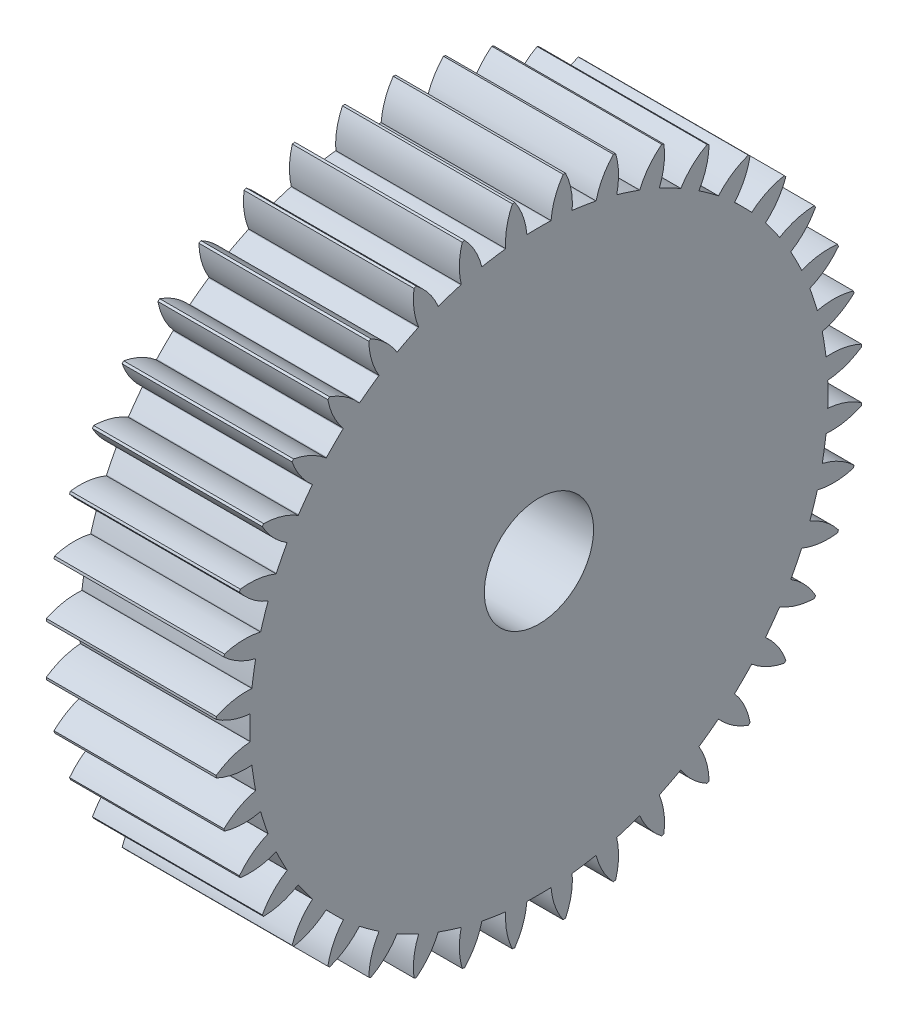
from build123d import *

# Parameters (mm, degrees)
SKETCH1_R                = 133.35
BOSS_EXTRUDE1_DEPTH      = 35
SKETCH6_R                = 22.5
CUT_EXTRUDE4_DEPTH       = 202.157761471
CUT_EXTRUDE5_DEPTH       = 202.157761471
FILLET2_R                = 170
CIRPATTERN2_COUNT        = 40
FILLET2_OF_CIRPATTERN2_R = 170


with BuildPart() as part:
    # Sketch1 → Boss-Extrude1 (new, symmetric)
    with BuildSketch(Plane(origin=(0, 0, 0), x_dir=(0, 0, -1), z_dir=(1, 0, 0))):
        Circle(SKETCH1_R)
    extrude(amount=BOSS_EXTRUDE1_DEPTH, both=True)

    # Sketch6 → Cut-Extrude4 (cut, through all)
    with BuildSketch(Plane(origin=(35, 0, 0), x_dir=(0, 0, -1), z_dir=(1, 0, 0))):
        Circle(SKETCH6_R)
    extrude(amount=-CUT_EXTRUDE4_DEPTH, mode=Mode.SUBTRACT)

    # Sketch7 → Cut-Extrude5 (cut, through all)
    with BuildSketch(Plane(origin=(35, 0, 0), x_dir=(0, 0, -1), z_dir=(1, 0, 0))):
        with BuildLine():
            Line((0, 119.099984062), (-4.985, 118.960598519))
            ThreePointArc((-4.985, 118.960598519), (-6.564205973, 126.294544475), (-9.975, 132.976395932))
            Line((-9.975, 132.976395932), (0, 140.975848521))
            Line((0, 140.975848521), (9.975, 132.976395932))
            ThreePointArc((9.975, 132.976395932), (6.564205973, 126.294544475), (4.985, 118.960598519))
            Line((4.985, 118.960598519), (0, 119.099984062))
        make_face()
    cut_extrude5 = extrude(amount=-CUT_EXTRUDE5_DEPTH, mode=Mode.SUBTRACT)

    # Fillet2
    # the kernel refuses this fillet: 170 mm, written as the material it takes off along each edge
    with BuildSketch(Plane(origin=(46.883421439, 119.099984062, 0), x_dir=(0, -0.027950067836470454, -0.9996093205387477), z_dir=(-1, 0, 0))) as fillet2_piece_1:
        with BuildLine():
            CenterArc((FILLET2_R * 0.0279609916216, FILLET2_R), FILLET2_R, 266.796740992, 3.203259008)
            Line((-FILLET2_R * 0.0279173050164, FILLET2_R * 0.00156241258413), (0, 0))
            Line((0, 0), (FILLET2_R * 0.0279609916216, 0))
        make_face()
    extrude(amount=93.766842878, mode=Mode.SUBTRACT)

    # CirPattern2: Cut-Extrude5 ×40 about axis
    cirpattern2_axis = Axis((0, 0, 0), (1, 0, 0))
    for i in range(1, CIRPATTERN2_COUNT):
        add(cut_extrude5.rotate(cirpattern2_axis, i * 360 / CIRPATTERN2_COUNT), mode=Mode.SUBTRACT)

    # Fillet2 of CirPattern2
    # the kernel refuses this fillet: 170 mm, written as the material it takes off along each edge
    with BuildSketch(Plane(origin=(46.883421439, 117.633665623, 18.631342293), x_dir=(0, -0.18397930542863158, 0.9829301171365126), z_dir=(-1, 0, 0)), Plane(origin=(46.883421439, 113.270815933, 36.803919105), x_dir=(0, -0.3354783619288289, 0.9420479120923467), z_dir=(-1, 0, 0)), Plane(origin=(46.883421439, 106.11886283, 54.070261283), x_dir=(0, -0.47871682776949775, 0.877969360974692), z_dir=(-1, 0, 0)), Plane(origin=(46.883421439, 96.353911136, 70.00521418), x_dir=(0, -0.6101676965404085, 0.7922722903765926), z_dir=(-1, 0, 0)), Plane(origin=(46.883421439, 84.21640637, 84.21640637), x_dir=(0, -0.7265942115920125, 0.687066846588439), z_dir=(-1, 0, 0)), Plane(origin=(46.883421439, 70.00521418, 96.353911136), x_dir=(0, -0.8251295657262981, 0.5649435367931301), z_dir=(-1, 0, 0)), Plane(origin=(46.883421439, 54.070261283, 106.11886283), x_dir=(0, -0.9033474915043593, 0.42890944218189164), z_dir=(-1, 0, 0)), Plane(origin=(46.883421439, 36.803919105, 113.270815933), x_dir=(0, -0.9593220040031472, 0.2823141736353062), z_dir=(-1, 0, 0)), Plane(origin=(46.883421439, 18.631342293, 117.633665623), x_dir=(0, -0.9916748249561845, 0.12876739318678812), z_dir=(-1, 0, 0)), Plane(origin=(46.883421439, 0, 119.099984062), x_dir=(0, -0.9996093205387477, -0.027950067836470454), z_dir=(-1, 0, 0)), Plane(origin=(46.883421439, -18.631342293, 117.633665623), x_dir=(0, -0.9829301171365137, -0.1839793054286258), z_dir=(-1, 0, 0)), Plane(origin=(46.883421439, -36.803919105, 113.270815933), x_dir=(0, -0.942047912092344, -0.33547836192883684), z_dir=(-1, 0, 0)), Plane(origin=(46.883421439, -54.070261283, 106.11886283), x_dir=(0, -0.8779693609746907, -0.47871682776950003), z_dir=(-1, 0, 0)), Plane(origin=(46.883421439, -70.00521418, 96.353911136), x_dir=(0, -0.792272290376593, -0.610167696540408), z_dir=(-1, 0, 0)), Plane(origin=(46.883421439, -84.21640637, 84.21640637), x_dir=(0, -0.6870668465884329, -0.7265942115920184), z_dir=(-1, 0, 0)), Plane(origin=(46.883421439, -96.353911136, 70.00521418), x_dir=(0, -0.5649435367931425, -0.8251295657262897), z_dir=(-1, 0, 0)), Plane(origin=(46.883421439, -106.11886283, 54.070261283), x_dir=(0, -0.4289094421818952, -0.9033474915043576), z_dir=(-1, 0, 0)), Plane(origin=(46.883421439, -113.270815933, 36.803919105), x_dir=(0, -0.28231417363530026, -0.9593220040031488), z_dir=(-1, 0, 0)), Plane(origin=(46.883421439, -117.633665623, 18.631342293), x_dir=(0, -0.1287673931867822, -0.9916748249561853), z_dir=(-1, 0, 0)), Plane(origin=(46.883421439, -119.099984062, 0), x_dir=(0, 0.02795006783647045, -0.9996093205387477), z_dir=(-1, 0, 0)), Plane(origin=(46.883421439, -117.633665623, -18.631342293), x_dir=(0, 0.1839793054286258, -0.9829301171365137), z_dir=(-1, 0, 0)), Plane(origin=(46.883421439, -113.270815933, -36.803919105), x_dir=(0, 0.3354783619288342, -0.9420479120923448), z_dir=(-1, 0, 0)), Plane(origin=(46.883421439, -106.11886283, -54.070261283), x_dir=(0, 0.4787168277694925, -0.8779693609746948), z_dir=(-1, 0, 0)), Plane(origin=(46.883421439, -96.353911136, -70.00521418), x_dir=(0, 0.6101676965404085, -0.7922722903765926), z_dir=(-1, 0, 0)), Plane(origin=(46.883421439, -84.21640637, -84.21640637), x_dir=(0, 0.7265942115920125, -0.687066846588439), z_dir=(-1, 0, 0)), Plane(origin=(46.883421439, -70.00521418, -96.353911136), x_dir=(0, 0.8251295657262934, -0.564943536793137), z_dir=(-1, 0, 0)), Plane(origin=(46.883421439, -54.070261283, -106.11886283), x_dir=(0, 0.9033474915043574, -0.4289094421818958), z_dir=(-1, 0, 0)), Plane(origin=(46.883421439, -36.803919105, -113.270815933), x_dir=(0, 0.9593220040031472, -0.2823141736353062), z_dir=(-1, 0, 0)), Plane(origin=(46.883421439, -18.631342293, -117.633665623), x_dir=(0, 0.9916748249561853, -0.1287673931867821), z_dir=(-1, 0, 0)), Plane(origin=(46.883421439, 0, -119.099984062), x_dir=(0, 0.9996093205387477, 0.027950067836470454), z_dir=(-1, 0, 0)), Plane(origin=(46.883421439, 18.631342293, -117.633665623), x_dir=(0, 0.9829301171365135, 0.18397930542862592), z_dir=(-1, 0, 0)), Plane(origin=(46.883421439, 36.803919105, -113.270815933), x_dir=(0, 0.9420479120923448, 0.3354783619288342), z_dir=(-1, 0, 0)), Plane(origin=(46.883421439, 54.070261283, -106.11886283), x_dir=(0, 0.8779693609746873, 0.4787168277695065), z_dir=(-1, 0, 0)), Plane(origin=(46.883421439, 70.00521418, -96.353911136), x_dir=(0, 0.7922722903765919, 0.6101676965404095), z_dir=(-1, 0, 0)), Plane(origin=(46.883421439, 84.21640637, -84.21640637), x_dir=(0, 0.6870668465884329, 0.7265942115920184), z_dir=(-1, 0, 0)), Plane(origin=(46.883421439, 106.11886283, -54.070261283), x_dir=(0, 0.4289094421818988, 0.9033474915043559), z_dir=(-1, 0, 0)), Plane(origin=(46.883421439, 113.270815933, -36.803919105), x_dir=(0, 0.28231417363530026, 0.9593220040031488), z_dir=(-1, 0, 0)), Plane(origin=(46.883421439, 117.633665623, -18.631342293), x_dir=(0, 0.12876739318678204, 0.9916748249561853), z_dir=(-1, 0, 0))) as fillet2_of_cirpattern2_piece_1:
        with BuildLine():
            CenterArc((FILLET2_OF_CIRPATTERN2_R * 0.0279609916216, -FILLET2_OF_CIRPATTERN2_R), FILLET2_OF_CIRPATTERN2_R, 90, 3.203259008)
            Line((-FILLET2_OF_CIRPATTERN2_R * 0.0279173050164, -FILLET2_OF_CIRPATTERN2_R * 0.00156241258413), (0, 0))
            Line((0, 0), (FILLET2_OF_CIRPATTERN2_R * 0.0279609916216, 0))
        make_face()
    extrude(amount=93.766842878, mode=Mode.SUBTRACT)
    with BuildSketch(Plane(origin=(46.883421439, 96.353911136, -70.00521418), x_dir=(0, -0.6101676965404099, -0.7922722903765916), z_dir=(-1, 0, 0))) as fillet2_of_cirpattern2_piece_2:
        with BuildLine():
            CenterArc((FILLET2_OF_CIRPATTERN2_R * 0.0279609916216, FILLET2_OF_CIRPATTERN2_R), FILLET2_OF_CIRPATTERN2_R, 266.796740992, 3.203259008)
            Line((-FILLET2_OF_CIRPATTERN2_R * 0.0279173050164, FILLET2_OF_CIRPATTERN2_R * 0.00156241258413), (0, 0))
            Line((0, 0), (FILLET2_OF_CIRPATTERN2_R * 0.0279609916216, 0))
        make_face()
    extrude(amount=93.766842878, mode=Mode.SUBTRACT)


solid = part.part
